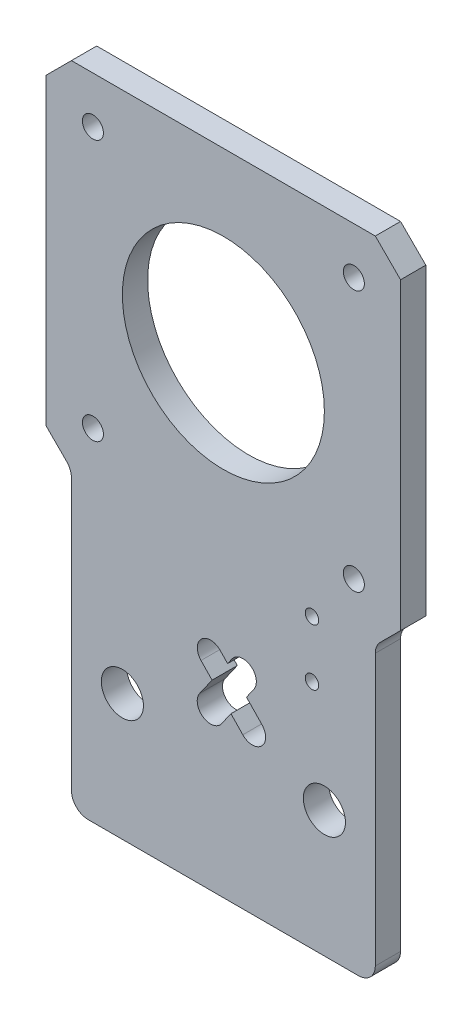
from build123d import *

# Parameters (mm, degrees)
SKETCH1_R                   = 12
BOSS_EXTRUDE1_DEPTH         = 3
TAP_DRILL_FOR_M3_TAP1_D     = 2.5
TAP_DRILL_FOR_M3_TAP1_DEPTH = 5
TAP_DRILL_FOR_M3_TAP1_TIP   = 0.751075774
TAP_DRILL_FOR_M4_TAP1_D     = 5
TAP_DRILL_FOR_M4_TAP1_DEPTH = 5
TAP_DRILL_FOR_M4_TAP1_TIP   = 1.502151548
FILLET1_R                   = 2
TAP_DRILL_FOR_M2_TAP1_D     = 1.6
TAP_DRILL_FOR_M2_TAP1_DEPTH = 5
TAP_DRILL_FOR_M2_TAP1_TIP   = 0.480688495
CUT_EXTRUDE1_DEPTH          = 10


with BuildPart() as part:
    # Sketch1 → Boss-Extrude1 (new body)
    with BuildSketch(Plane.XY):
        Polygon((18.05, -56.055), (18.05, -21.05), (21.05, -18.05), (21.05, 18.05), (18.05, 21.05), (-18.05, 21.05), (-21.05, 18.05), (-21.05, -18.05), (-18.05, -21.05), (-18.05, -56.055), align=None)
        Circle(SKETCH1_R, mode=Mode.SUBTRACT)
    extrude(amount=BOSS_EXTRUDE1_DEPTH)

    # Tap Drill for M3 Tap1
    with Locations(Plane.XY.offset(3)):
        with Locations((-15.5, 15.5), (15.5, 15.5), (-15.5, -15.5), (15.5, -15.5)):
            Hole(TAP_DRILL_FOR_M3_TAP1_D / 2, depth=TAP_DRILL_FOR_M3_TAP1_DEPTH)
            with Locations((0, 0, -(TAP_DRILL_FOR_M3_TAP1_DEPTH + TAP_DRILL_FOR_M3_TAP1_TIP / 2))):  # 118° drill point
                Cone(0, TAP_DRILL_FOR_M3_TAP1_D / 2, TAP_DRILL_FOR_M3_TAP1_TIP, mode=Mode.SUBTRACT)

    # Tap Drill for M4 Tap1
    with Locations(Plane.XY.offset(3)):
        with Locations((12, -41.055), (-12, -41.055)):
            Hole(TAP_DRILL_FOR_M4_TAP1_D / 2, depth=TAP_DRILL_FOR_M4_TAP1_DEPTH)
            with Locations((0, 0, -(TAP_DRILL_FOR_M4_TAP1_DEPTH + TAP_DRILL_FOR_M4_TAP1_TIP / 2))):  # 118° drill point
                Cone(0, TAP_DRILL_FOR_M4_TAP1_D / 2, TAP_DRILL_FOR_M4_TAP1_TIP, mode=Mode.SUBTRACT)

    # Fillet1
    fillet1_edges = [part.edges().sort_by_distance(p)[0] for p in [
        (18.05, -21.05, 1.5),
        (18.05, -56.055, 1.5),
        (-18.05, -56.055, 1.5),
        (-18.05, -21.05, 1.5),
    ]]
    fillet(fillet1_edges, radius=FILLET1_R)

    # Tap Drill for M2 Tap1
    with Locations(Plane.XY.offset(3)):
        with Locations((10.52945603, -21.86131015), (10.52945603, -28.56131015)):
            Hole(TAP_DRILL_FOR_M2_TAP1_D / 2, depth=TAP_DRILL_FOR_M2_TAP1_DEPTH)
            with Locations((0, 0, -(TAP_DRILL_FOR_M2_TAP1_DEPTH + TAP_DRILL_FOR_M2_TAP1_TIP / 2))):  # 118° drill point
                Cone(0, TAP_DRILL_FOR_M2_TAP1_D / 2, TAP_DRILL_FOR_M2_TAP1_TIP, mode=Mode.SUBTRACT)

    # Sketch8 → Cut-Extrude1 (cut)
    with BuildSketch(Plane.XY):
        with BuildLine():
            Line((-0.221262765, -38.266132411), (0.899883871, -36.671612752))
            Line((0.899883871, -36.671612752), (2.309224727, -38.137860411))
            ThreePointArc((2.309224727, -38.137860411), (4.536251377, -38.181932421), (4.580323387, -35.954905771))
            Line((4.580323387, -35.954905771), (2.745800968, -34.046308435))
            Line((2.745800968, -34.046308435), (3.626081735, -32.794353566))
            ThreePointArc((3.626081735, -32.794353566), (3.24055354, -30.582639184), (1.028839157, -30.968167379))
            Line((1.028839157, -30.968167379), (0.504250938, -31.714248402))
            Line((0.504250938, -31.714248402), (-0.384334723, -30.789783153))
            ThreePointArc((-0.384334723, -30.789783153), (-2.611361373, -30.745711142), (-2.655433384, -32.972737792))
            Line((-2.655433384, -32.972737792), (-1.341666159, -34.339552718))
            Line((-1.341666159, -34.339552718), (-2.818505343, -36.439946223))
            ThreePointArc((-2.818505343, -36.439946223), (-2.432977147, -38.651660606), (-0.221262765, -38.266132411))
        make_face()
    extrude(amount=CUT_EXTRUDE1_DEPTH, mode=Mode.SUBTRACT)


solid = part.part
